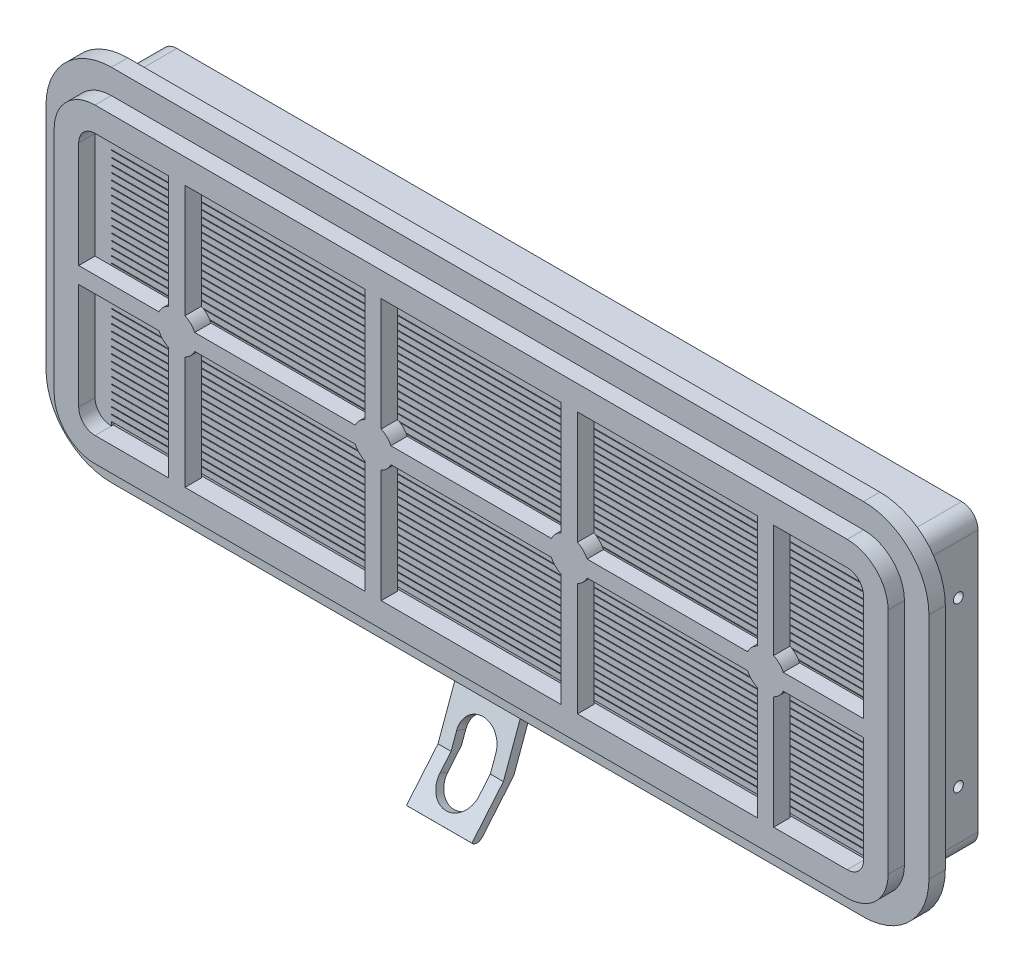
from build123d import *

# Parameters (mm, degrees)
BOSS_EXTRU_1_DEPTH         = 50
BOSS_EXTRU_3_DEPTH         = 5
BOSS_EXTRU_4_DEPTH         = 5
BOSS_EXTRU_5_DEPTH         = 5
R_P_TITION_LIN_AIRE1_COUNT = 4
R_P_TITION_LIN_AIRE1_PITCH = 60
ESQUISSE5_W                = 240
ESQUISSE5_H                = 5
BOSS_EXTRU_6_DEPTH         = 5
BOSS_EXTRU_8_DEPTH         = 10
BOSS_EXTRU_8_DEPTH_BACK    = 10
ENL_V_MAT_EXTRU_1_DEPTH    = 171.478008462
BOSS_EXTRU_9_DEPTH         = 230
R_P_TITION_LIN_AIRE2_COUNT = 37
R_P_TITION_LIN_AIRE2_PITCH = 2
ESQUISSE12_W               = 10
ESQUISSE12_H               = 80
EXTRU_MINCE1_DEPTH         = 5
BOSS_EXTRU_13_DEPTH        = 5
ESQUISSE14_W               = 230
ESQUISSE14_H               = 7.980019599
BOSS_EXTRU_14_DEPTH        = 5.75
ENL_V_MAT_EXTRU_2_DEPTH    = 30
ESQUISSE16_R               = 1.5
ENL_V_MAT_EXTRU_3_DEPTH    = 282.216612895


with BuildPart() as part:
    # Esquisse1 → Boss.-Extru.1 (new body)
    with BuildSketch(Plane.XY):
        with BuildLine():
            Line((-120, 45), (120, 45))
            ThreePointArc((120, 45), (123.535533906, 43.535533906), (125, 40))
            Line((125, 40), (125, -40))
            ThreePointArc((125, -40), (123.535533906, -43.535533906), (120, -45))
            Line((120, -45), (-120, -45))
            ThreePointArc((-120, -45), (-123.535533906, -43.535533906), (-125, -40))
            Line((-125, -40), (-125, 40))
            ThreePointArc((-125, 40), (-123.535533906, 43.535533906), (-120, 45))
        make_face()
        with BuildLine():
            Line((-115, 40), (115, 40))
            ThreePointArc((115, 40), (118.535533906, 38.535533906), (120, 35))
            Line((120, 35), (120, -35))
            ThreePointArc((120, -35), (118.535533906, -38.535533906), (115, -40))
            Line((115, -40), (-115, -40))
            ThreePointArc((-115, -40), (-118.535533906, -38.535533906), (-120, -35))
            Line((-120, -35), (-120, 35))
            ThreePointArc((-120, 35), (-118.535533906, 38.535533906), (-115, 40))
        make_face(mode=Mode.SUBTRACT)
    extrude(amount=BOSS_EXTRU_1_DEPTH)

    # Esquisse2 → Boss.-Extru.3 (add)
    with BuildSketch(Plane.XY.offset(50)):
        with BuildLine():
            Line((-115, -55), (115, -55))
            ThreePointArc((115, -55), (129.142135624, -49.142135624), (135, -35))
            Line((135, -35), (135, 35))
            ThreePointArc((135, 35), (129.142135624, 49.142135624), (115, 55))
            Line((115, 55), (-115, 55))
            ThreePointArc((-115, 55), (-129.142135624, 49.142135624), (-135, 35))
            Line((-135, 35), (-135, -35))
            ThreePointArc((-135, -35), (-129.142135624, -49.142135624), (-115, -55))
        make_face()
        with BuildLine():
            Line((-115, -40), (115, -40))
            ThreePointArc((115, -40), (118.535533906, -38.535533906), (120, -35))
            Line((120, -35), (120, 35))
            ThreePointArc((120, 35), (118.535533906, 38.535533906), (115, 40))
            Line((115, 40), (-115, 40))
            ThreePointArc((-115, 40), (-118.535533906, 38.535533906), (-120, 35))
            Line((-120, 35), (-120, -35))
            ThreePointArc((-120, -35), (-118.535533906, -38.535533906), (-115, -40))
        make_face(mode=Mode.SUBTRACT)
    extrude(amount=BOSS_EXTRU_3_DEPTH)

    # Esquisse3 → Boss.-Extru.4 (add)
    with BuildSketch(Plane.XY.offset(55)):
        with BuildLine():
            Line((-127.5, 35), (-127.5, -35))
            ThreePointArc((-127.5, -35), (-123.838834765, -43.838834765), (-115, -47.5))
            Line((-115, -47.5), (115, -47.5))
            ThreePointArc((115, -47.5), (123.838834765, -43.838834765), (127.5, -35))
            Line((127.5, -35), (127.5, 35))
            ThreePointArc((127.5, 35), (123.838834765, 43.838834765), (115, 47.5))
            Line((115, 47.5), (-115, 47.5))
            ThreePointArc((-115, 47.5), (-123.838834765, 43.838834765), (-127.5, 35))
        make_face()
        with BuildLine():
            Line((-120, 35), (-120, -35))
            ThreePointArc((-120, -35), (-118.535533906, -38.535533906), (-115, -40))
            Line((-115, -40), (115, -40))
            ThreePointArc((115, -40), (118.535533906, -38.535533906), (120, -35))
            Line((120, -35), (120, 35))
            ThreePointArc((120, 35), (118.535533906, 38.535533906), (115, 40))
            Line((115, 40), (-115, 40))
            ThreePointArc((-115, 40), (-118.535533906, 38.535533906), (-120, 35))
        make_face(mode=Mode.SUBTRACT)
    extrude(amount=BOSS_EXTRU_4_DEPTH)

    # Esquisse4 → Boss.-Extru.5 (add)
    with BuildSketch(Plane.XY.offset(60)):
        with BuildLine():
            Line((-92.5, -5.454356057), (-92.5, -40))
            Line((-92.5, -40), (-87.5, -40))
            Line((-87.5, -40), (-87.5, -5.454356057))
            ThreePointArc((-87.5, -5.454356057), (-84, 0), (-87.5, 5.454356057))
            Line((-87.5, 5.454356057), (-87.5, 40))
            Line((-87.5, 40), (-92.5, 40))
            Line((-92.5, 40), (-92.5, 5.454356057))
            ThreePointArc((-92.5, 5.454356057), (-96, 0), (-92.5, -5.454356057))
        make_face()
    boss_extru_5 = extrude(amount=-BOSS_EXTRU_5_DEPTH)

    # Répétition linéaire1: Boss.-Extru.5 ×4
    with Locations(*[(i * R_P_TITION_LIN_AIRE1_PITCH, 0, 0) for i in range(1, R_P_TITION_LIN_AIRE1_COUNT)]):
        add(boss_extru_5)

    # Esquisse5 → Boss.-Extru.6 (add)
    with BuildSketch(Plane.XY.offset(60)):
        Rectangle(ESQUISSE5_W, ESQUISSE5_H)
    extrude(amount=-BOSS_EXTRU_6_DEPTH)

    # Esquisse9 → Boss.-Extru.8 (add, two sides: drawn at the far end of the back side and taken through both)
    with BuildSketch(Plane(origin=(0, 0, 0), x_dir=(0, 0, -1), z_dir=(1, 0, 0)).offset(-BOSS_EXTRU_8_DEPTH_BACK)):
        with BuildLine():
            Line((-55, -55), (-60.13030215, -69.095389312))
            Line((-60.13030215, -69.095389312), (-69.772116295, -80.586055959))
            ThreePointArc((-69.772116295, -80.586055959), (-68.175849636, -81.330407326), (-66.579582978, -80.586055959))
            Line((-66.579582978, -80.586055959), (-56.937768832, -69.095389312))
            Line((-56.937768832, -69.095389312), (-51.596033245, -54.419091406))
            Line((-51.596033245, -54.419091406), (-55, -55))
        make_face()
    extrude(amount=BOSS_EXTRU_8_DEPTH + BOSS_EXTRU_8_DEPTH_BACK)

    # Esquisse10 → Enlèv. mat.-Extru.1 (cut, through all)
    with BuildSketch(Plane(origin=(0, 14.663082885, 40.286489127), x_dir=(1, 0, 0), z_dir=(0, 0.34202014332566943, 0.9396926207859083))):
        with BuildLine():
            Line((-6, -80.494202026), (-6, -90.494202026))
            ThreePointArc((-6, -90.494202026), (0, -96.494202026), (6, -90.494202026))
            Line((6, -90.494202026), (6, -80.494202026))
            ThreePointArc((6, -80.494202026), (0, -74.494202026), (-6, -80.494202026))
        make_face()
    extrude(amount=-ENL_V_MAT_EXTRU_1_DEPTH, mode=Mode.SUBTRACT)

    # Esquisse11 → Boss.-Extru.9 (add)
    with BuildSketch(Plane.ZY.offset(-115)):
        with BuildLine():
            ThreePointArc((55, 35), (54.856625225, 34.649545368), (54.508726203, 34.500076152))
            Line((54.508726203, 34.500076152), (46.529922, 34.360805607))
            ThreePointArc((46.529922, 34.360805607), (46.284285101, 34.110843683), (46.529922, 33.860881759))
            Line((46.529922, 33.860881759), (54.508726203, 33.721611214))
            ThreePointArc((54.508726203, 33.721611214), (54.856625225, 33.572141999), (55, 33.221687366))
            Line((55, 33.221687366), (55, 35))
        make_face()
    boss_extru_9 = extrude(amount=BOSS_EXTRU_9_DEPTH)

    # Répétition linéaire2: Boss.-Extru.9 ×37
    with Locations(*[(0, -i * R_P_TITION_LIN_AIRE2_PITCH, 0) for i in range(1, R_P_TITION_LIN_AIRE2_COUNT)]):
        add(boss_extru_9)

    # Esquisse12 → Extru.-Mince1 (add)
    with BuildSketch(Plane.ZY.offset(115)):
        with Locations((45, 0)):
            Rectangle(ESQUISSE12_W, ESQUISSE12_H)
    extru_mince1 = extrude(amount=EXTRU_MINCE1_DEPTH)

    # Esquisse13 → Boss.-Extru.13 (add)
    with BuildSketch(Plane.XY.offset(50)):
        with BuildLine():
            Line((-120, 35), (-120, -35))
            ThreePointArc((-120, -35), (-118.535533906, -38.535533906), (-115, -40))
            Line((-115, -40), (-115, -38.199688677))
            Line((-115, -38.199688677), (-115, -37.578623956))
            Line((-115, -37.578623956), (-115, -36.199688677))
            Line((-115, -36.199688677), (-115, -35.578623956))
            Line((-115, -35.578623956), (-115, -34.199688677))
            Line((-115, -34.199688677), (-115, -33.578623956))
            Line((-115, -33.578623956), (-115, -32.199688677))
            Line((-115, -32.199688677), (-115, -31.578623956))
            Line((-115, -31.578623956), (-115, -30.199688677))
            Line((-115, -30.199688677), (-115, -29.578623956))
            Line((-115, -29.578623956), (-115, -28.199688677))
            Line((-115, -28.199688677), (-115, -27.578623956))
            Line((-115, -27.578623956), (-115, -26.199688677))
            Line((-115, -26.199688677), (-115, -25.578623956))
            Line((-115, -25.578623956), (-115, -24.199688677))
            Line((-115, -24.199688677), (-115, -23.578623956))
            Line((-115, -23.578623956), (-115, -22.199688677))
            Line((-115, -22.199688677), (-115, -21.578623956))
            Line((-115, -21.578623956), (-115, -20.199688677))
            Line((-115, -20.199688677), (-115, -19.578623956))
            Line((-115, -19.578623956), (-115, -18.199688677))
            Line((-115, -18.199688677), (-115, -17.578623956))
            Line((-115, -17.578623956), (-115, -16.199688677))
            Line((-115, -16.199688677), (-115, -15.578623956))
            Line((-115, -15.578623956), (-115, -14.199688677))
            Line((-115, -14.199688677), (-115, -13.578623956))
            Line((-115, -13.578623956), (-115, -12.199688677))
            Line((-115, -12.199688677), (-115, -11.578623956))
            Line((-115, -11.578623956), (-115, -10.199688677))
            Line((-115, -10.199688677), (-115, -9.578623956))
            Line((-115, -9.578623956), (-115, -8.199688677))
            Line((-115, -8.199688677), (-115, -7.578623956))
            Line((-115, -7.578623956), (-115, -6.199688677))
            Line((-115, -6.199688677), (-115, -5.578623956))
            Line((-115, -5.578623956), (-115, -4.199688677))
            Line((-115, -4.199688677), (-115, -3.578623956))
            Line((-115, -3.578623956), (-115, -2.199688677))
            Line((-115, -2.199688677), (-115, -1.578623956))
            Line((-115, -1.578623956), (-115, -0.199688677))
            Line((-115, -0.199688677), (-115, 0.421376044))
            Line((-115, 0.421376044), (-115, 1.800311323))
            Line((-115, 1.800311323), (-115, 2.421376044))
            Line((-115, 2.421376044), (-115, 3.800311323))
            Line((-115, 3.800311323), (-115, 4.421376044))
            Line((-115, 4.421376044), (-115, 5.800311323))
            Line((-115, 5.800311323), (-115, 6.421376044))
            Line((-115, 6.421376044), (-115, 7.800311323))
            Line((-115, 7.800311323), (-115, 8.421376044))
            Line((-115, 8.421376044), (-115, 9.800311323))
            Line((-115, 9.800311323), (-115, 10.421376044))
            Line((-115, 10.421376044), (-115, 11.800311323))
            Line((-115, 11.800311323), (-115, 12.421376044))
            Line((-115, 12.421376044), (-115, 13.800311323))
            Line((-115, 13.800311323), (-115, 14.421376044))
            Line((-115, 14.421376044), (-115, 15.800311323))
            Line((-115, 15.800311323), (-115, 16.421376044))
            Line((-115, 16.421376044), (-115, 17.800311323))
            Line((-115, 17.800311323), (-115, 18.421376044))
            Line((-115, 18.421376044), (-115, 19.800311323))
            Line((-115, 19.800311323), (-115, 20.421376044))
            Line((-115, 20.421376044), (-115, 21.800311323))
            Line((-115, 21.800311323), (-115, 22.421376044))
            Line((-115, 22.421376044), (-115, 23.800311323))
            Line((-115, 23.800311323), (-115, 24.421376044))
            Line((-115, 24.421376044), (-115, 25.800311323))
            Line((-115, 25.800311323), (-115, 26.421376044))
            Line((-115, 26.421376044), (-115, 27.800311323))
            Line((-115, 27.800311323), (-115, 28.421376044))
            Line((-115, 28.421376044), (-115, 29.800311323))
            Line((-115, 29.800311323), (-115, 30.421376044))
            Line((-115, 30.421376044), (-115, 31.800311323))
            Line((-115, 31.800311323), (-115, 32.421376044))
            Line((-115, 32.421376044), (-115, 33.800311323))
            Line((-115, 33.800311323), (-115, 34.421376044))
            Line((-115, 34.421376044), (-115, 40))
            ThreePointArc((-115, 40), (-118.535533906, 38.535533906), (-120, 35))
        make_face()
    boss_extru_13 = extrude(amount=BOSS_EXTRU_13_DEPTH)

    # Symétrie1: Extru.-Mince1 across plane
    add(extru_mince1.mirror(Plane(origin=(0, 0, 0), x_dir=(0, 0, 1), z_dir=(1, 0, 0))))

    # Symétrie2: Boss.-Extru.13 across plane
    add(boss_extru_13.mirror(Plane(origin=(0, 0, 0), x_dir=(0, 0, 1), z_dir=(1, 0, 0))))

    # Esquisse14 → Boss.-Extru.14 (add)
    with BuildSketch(Plane(origin=(0, 33.53840434, -0.585415025), x_dir=(1, 0, 0), z_dir=(0, 0.9998476951563913, -0.01745240643728475))):
        with Locations((0, -51.112523812)):
            Rectangle(ESQUISSE14_W, ESQUISSE14_H)
    boss_extru_14 = extrude(amount=BOSS_EXTRU_14_DEPTH)

    # Symétrie3: Boss.-Extru.14 across plane
    add(boss_extru_14.mirror(Plane.ZX))

    # Esquisse15 → Enlèv. mat.-Extru.2 (cut)
    with BuildSketch(Plane(origin=(0, 0, 0), x_dir=(-1, 0, 0), z_dir=(0, 0, -1))):
        with BuildLine():
            Line((-120, -45), (120, -45))
            ThreePointArc((120, -45), (123.535533906, -43.535533906), (125, -40))
            Line((125, -40), (125, 40))
            ThreePointArc((125, 40), (123.535533906, 43.535533906), (120, 45))
            Line((120, 45), (-120, 45))
            ThreePointArc((-120, 45), (-123.535533906, 43.535533906), (-125, 40))
            Line((-125, 40), (-125, -40))
            ThreePointArc((-125, -40), (-123.535533906, -43.535533906), (-120, -45))
        make_face()
        with BuildLine():
            Line((-115, -40), (115, -40))
            ThreePointArc((115, -40), (118.535533906, -38.535533906), (120, -35))
            Line((120, -35), (120, 35))
            ThreePointArc((120, 35), (118.535533906, 38.535533906), (115, 40))
            Line((115, 40), (-115, 40))
            ThreePointArc((-115, 40), (-118.535533906, 38.535533906), (-120, 35))
            Line((-120, 35), (-120, -35))
            ThreePointArc((-120, -35), (-118.535533906, -38.535533906), (-115, -40))
        make_face(mode=Mode.SUBTRACT)
    extrude(amount=-ENL_V_MAT_EXTRU_2_DEPTH, mode=Mode.SUBTRACT)

    # Esquisse16 → Enlèv. mat.-Extru.3 (cut, through all)
    with BuildSketch(Plane(origin=(125, 0, 0), x_dir=(0, 0, -1), z_dir=(1, 0, 0))):
        with Locations((-36, 25)):
            Circle(ESQUISSE16_R)
        with Locations((-36, -25)):
            Circle(ESQUISSE16_R)
    extrude(amount=-ENL_V_MAT_EXTRU_3_DEPTH, mode=Mode.SUBTRACT)


solid = part.part
